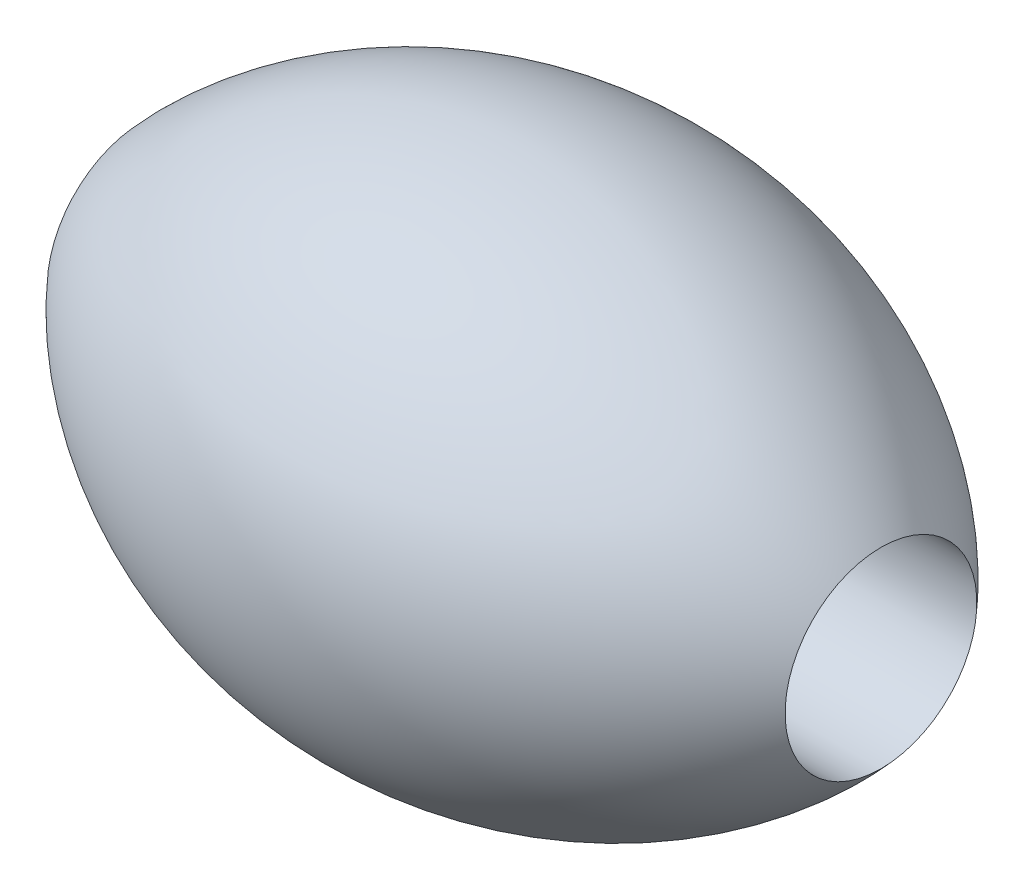
from build123d import *

# Parameters (mm, degrees)
INNER_START           = -5.537034875
INNER_LUMEN_OUTLINE_R = 1.1
INNER_LUMEN_DEPTH     = 10.0000002


# Read off the part's stored shape, not the designer's step: Inner Lumen
with BuildPart() as part:
    # Olive Tip → Revolve1 (revolve)
    with BuildSketch(Plane.XY):
        with BuildLine():
            Line((-5.537034775, 0), (4.462965225, 0))
            ThreePointArc((4.462965225, 0), (-0.537034775, -3), (-5.537034775, 0))
        make_face()
    revolve(axis=Axis((-5.537034775, 0, 0), (1, 0, 0)))

    # Inner Lumen outline → Inner Lumen (cut)
    with BuildSketch(Plane(origin=(0, 0, 0), x_dir=(0, 0, -1), z_dir=(1, 0, 0)).offset(INNER_START)):
        Circle(INNER_LUMEN_OUTLINE_R)
    extrude(amount=INNER_LUMEN_DEPTH, mode=Mode.SUBTRACT)


solid = part.part
